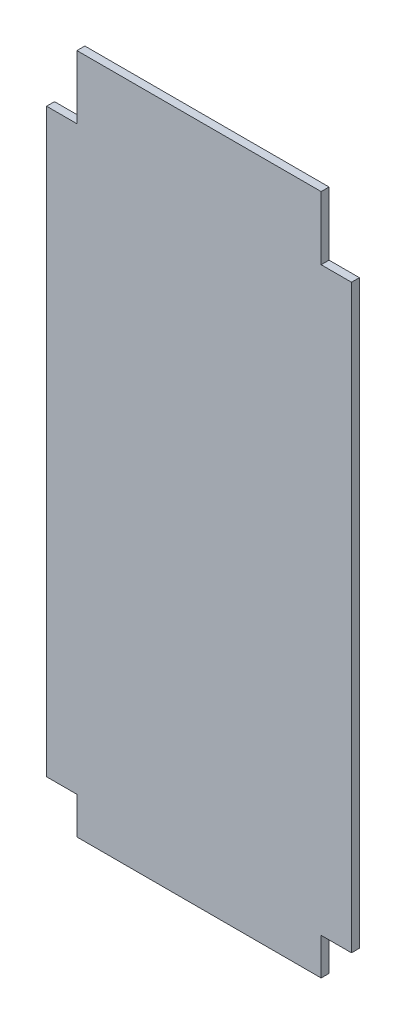
from build123d import *

# Parameters (mm, degrees)
BOSS_EXTRUDE1_DEPTH = 6


with BuildPart() as part:
    # Sketch1 → Boss-Extrude1 (new body)
    with BuildSketch(Plane.XY):
        Polygon((96.814780717, -418.58730627), (96.814780717, -390.58730627), (119.814780717, -390.58730627), (119.814780717, 49.41269373), (96.814780717, 49.41269373), (96.814780717, 97.41269373), (-88.185219283, 97.41269373), (-88.185219283, 49.41269373), (-111.185219283, 49.41269373), (-111.185219283, -390.58730627), (-88.185219283, -390.58730627), (-88.185219283, -418.58730627), align=None)
    extrude(amount=BOSS_EXTRUDE1_DEPTH)


solid = part.part
